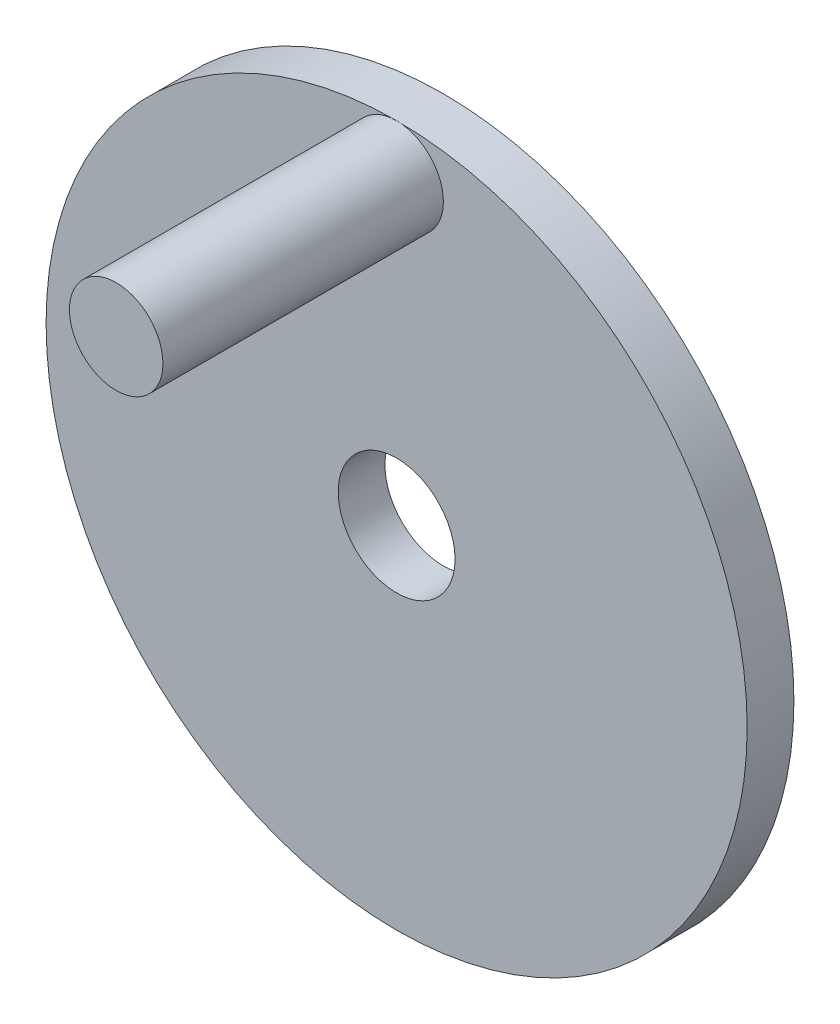
from build123d import *

# Parameters (mm, degrees)
SKETCH1_R           = 19.05
BOSS_EXTRUDE1_DEPTH = 2.54
SKETCH2_R           = 2.54
BOSS_EXTRUDE2_DEPTH = 15.24
SKETCH3_R           = 3.175
CUT_EXTRUDE1_DEPTH  = 31.952586322


with BuildPart() as part:
    # Sketch1 → Boss-Extrude1 (new body)
    with BuildSketch(Plane.XY):
        Circle(SKETCH1_R)
    extrude(amount=BOSS_EXTRUDE1_DEPTH)

    # Sketch2 → Boss-Extrude2 (add)
    with BuildSketch(Plane.XY.offset(2.54)):
        with Locations((0, 16.51)):
            Circle(SKETCH2_R)
    extrude(amount=BOSS_EXTRUDE2_DEPTH)

    # Sketch3 → Cut-Extrude1 (cut, through all)
    with BuildSketch(Plane.XY.offset(2.54)):
        Circle(SKETCH3_R)
    extrude(amount=-CUT_EXTRUDE1_DEPTH, mode=Mode.SUBTRACT)


solid = part.part
